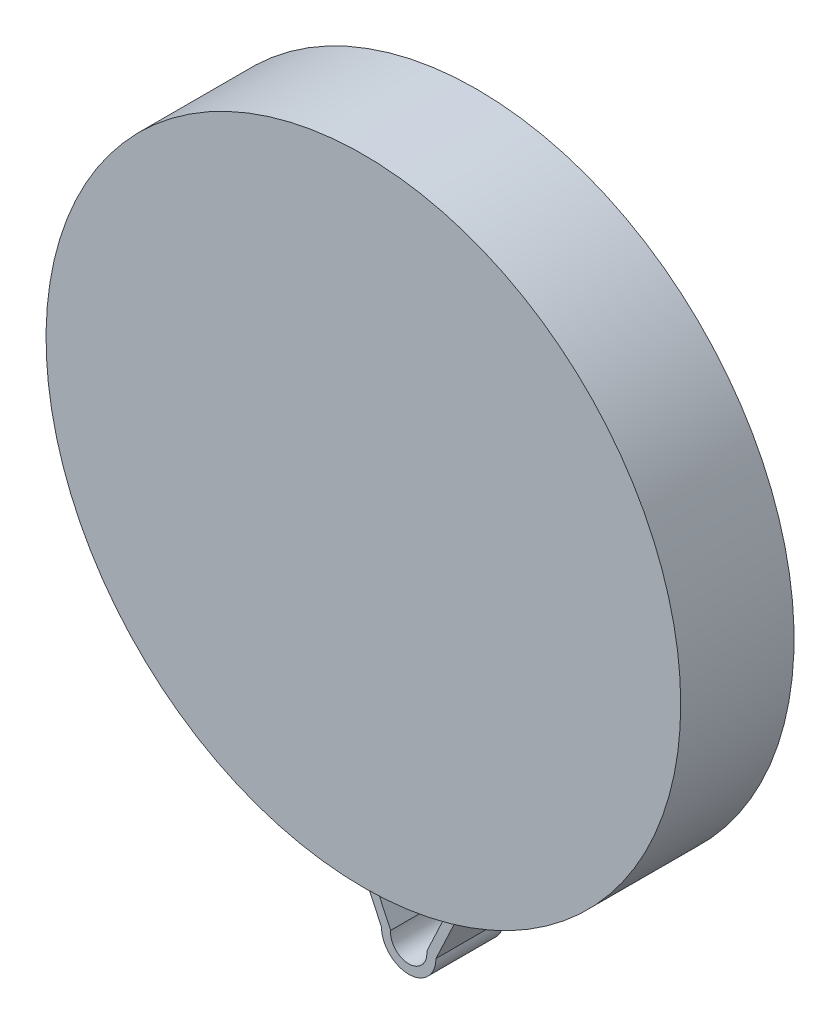
from build123d import *

# Parameters (mm, degrees)
SKETCH1_R           = 70
BOSS_EXTRUDE1_DEPTH = 25
SKETCH21_R          = 6
BOSS_EXTRUDE4_DEPTH = 15
CUT_EXTRUDE2_REACH  = 118.249
SKETCH22_R          = 3
SHELL15_START       = 2
SHELL15_OUTLINE_R   = 68
SHELL15_DEPTH       = 21
SHELL15_2_OUTLINE_R = 3
SHELL15_2_DEPTH     = 13


# Read off the part's stored shape, not the designer's step: Shell15
with BuildPart() as part:
    # Sketch1 → Boss-Extrude1 (new body)
    with BuildSketch(Plane.XY):
        Circle(SKETCH1_R)
    extrude(amount=BOSS_EXTRUDE1_DEPTH)

    # Sketch21 → Boss-Extrude4 (add)
    with BuildSketch(Plane.XY):
        with Locations((0, -85.59)):
            Circle(SKETCH21_R)
        with BuildLine():
            Line((-13.97898065, -68.59), (-6, -85.59))
            ThreePointArc((-6, -85.59), (0, -79.59), (6, -85.59))
            Line((6, -85.59), (13.97898065, -68.59))
            ThreePointArc((13.97898065, -68.59), (0, -70), (-13.97898065, -68.59))
        make_face()
    extrude(amount=BOSS_EXTRUDE4_DEPTH)

    # Sketch22 → Cut-Extrude2 (cut, up to next)
    with BuildSketch(Plane.XY.offset(15), mode=Mode.PRIVATE) as cut_extrude2_sk1:
        with Locations((0, -85.59)):
            Circle(SKETCH22_R)
    cut_extrude2_tool1 = extrude(cut_extrude2_sk1.sketch, amount=-CUT_EXTRUDE2_REACH, mode=Mode.PRIVATE) & part.part
    add(cut_extrude2_tool1.solids().sort_by_distance((0, -85.59, 15))[0], mode=Mode.SUBTRACT)

    # Shell15 outline → Shell15 (cut)
    with BuildSketch(Plane.XY.offset(SHELL15_START)):
        Circle(SHELL15_OUTLINE_R)
    extrude(amount=SHELL15_DEPTH, mode=Mode.SUBTRACT)

    # Shell15 2 outline → Shell15 2 (cut)
    with BuildSketch(Plane.XY.offset(SHELL15_START)):
        with BuildLine():
            ThreePointArc((12.599173957, -66.82260707), (0, -68), (-12.599173957, -66.82260707))
            Line((-12.599173957, -66.82260707), (-3.979676533, -85.187290811))
            ThreePointArc((-3.979676533, -85.187290811), (0, -89.59), (3.979676533, -85.187290811))
            Line((3.979676533, -85.187290811), (12.599173957, -66.82260707))
        make_face()
        with Locations((0, -85.59)):
            Circle(SHELL15_2_OUTLINE_R, mode=Mode.SUBTRACT)
    extrude(amount=SHELL15_2_DEPTH, mode=Mode.SUBTRACT)


solid = part.part
